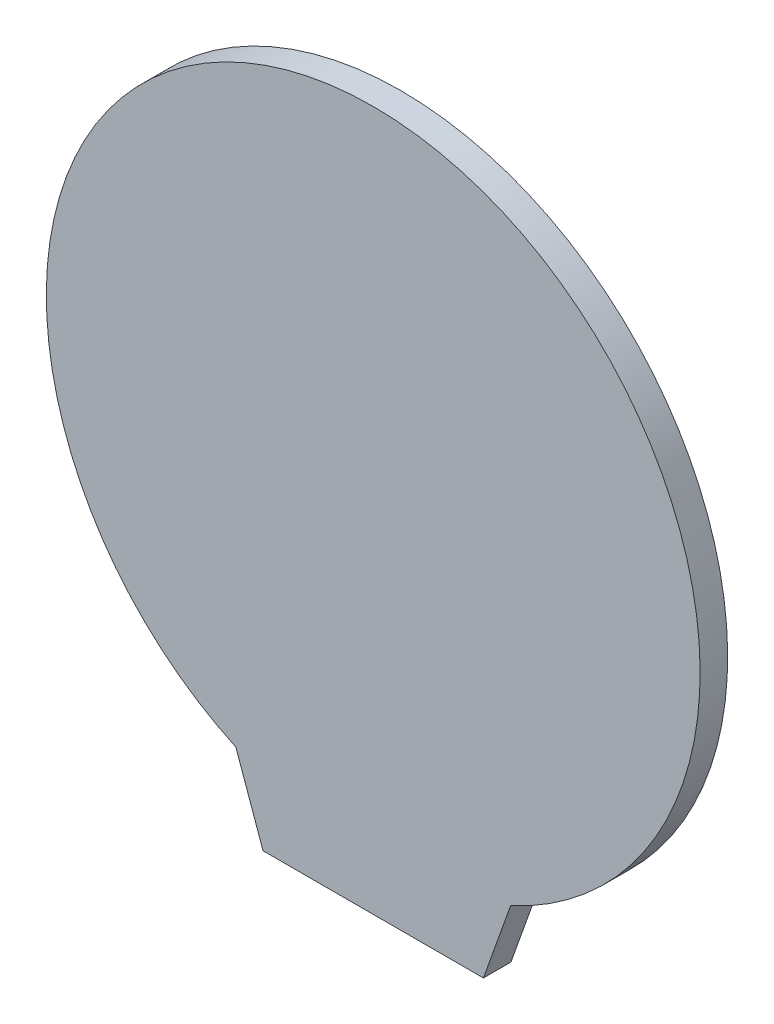
from build123d import *

# Parameters (mm, degrees)
EXTRUDE_1_DEPTH = 1.5


with BuildPart() as part:
    # 草图2 → 凸台-拉伸1 (new body)
    with BuildSketch(Plane.XY):
        with BuildLine():
            Line((-6, -20.3), (6, -20.3))
            Line((6, -20.3), (7.479773249, -16.152182272))
            ThreePointArc((7.479773249, -16.152182272), (0, 17.8), (-7.479773249, -16.152182272))
            Line((-7.479773249, -16.152182272), (-6, -20.3))
        make_face()
    extrude(amount=EXTRUDE_1_DEPTH)


solid = part.part
